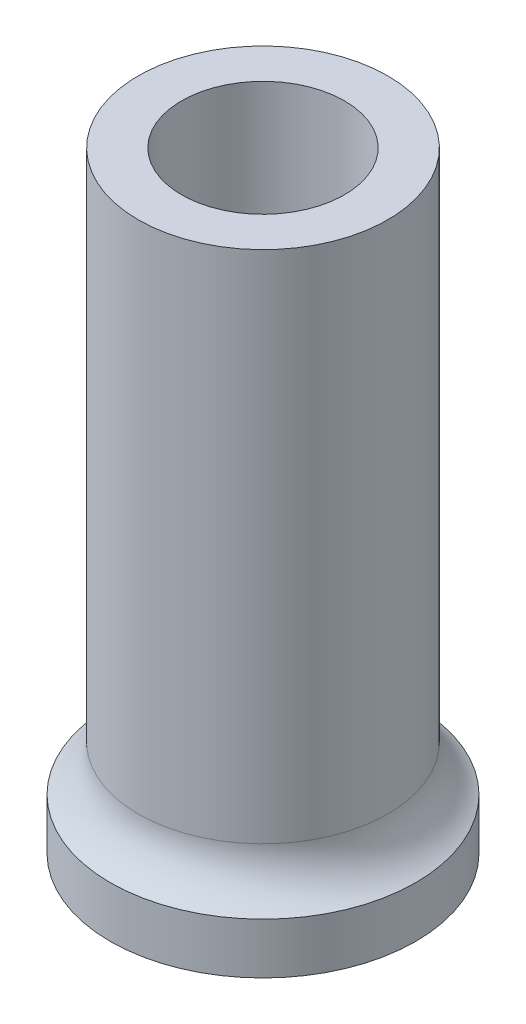
from build123d import *

# Parameters (mm, degrees)
SKETCH1_R           = 2.45
SKETCH1_R_2         = 1.5
BOSS_EXTRUDE1_DEPTH = 11
SKETCH2_R           = 3
BOSS_EXTRUDE2_DEPTH = 1
SKETCH3_R           = 1.6
CUT_EXTRUDE1_DEPTH  = 13.727922061
FILLET2_R           = 1


with BuildPart() as part:
    # Sketch1 → Boss-Extrude1 (new body)
    with BuildSketch(Plane(origin=(0, 0, 0), x_dir=(1, 0, 0), z_dir=(0, 1, 0))):
        with Locations(Location((0, 0, 0), (0, 0, 270))):
            Circle(SKETCH1_R)
        with Locations(Location((0, 0, 0), (0, 0, 270))):
            Circle(SKETCH1_R_2, mode=Mode.SUBTRACT)
    extrude(amount=BOSS_EXTRUDE1_DEPTH)

    # Sketch2 → Boss-Extrude2 (add)
    with BuildSketch(Plane(origin=(0, 0, 0), x_dir=(-1, 0, 0), z_dir=(0, -1, 0))):
        with Locations(Location((0, 0, 0), (0, 0, 90))):
            Circle(SKETCH2_R)
    extrude(amount=BOSS_EXTRUDE2_DEPTH)

    # Sketch3 → Cut-Extrude1 (cut, through all)
    with BuildSketch(Plane(origin=(0, -1, 0), x_dir=(-1, 0, 0), z_dir=(0, -1, 0))):
        with Locations(Location((0, 0, 0), (0, 0, 90))):
            Circle(SKETCH3_R)
    extrude(amount=-CUT_EXTRUDE1_DEPTH, mode=Mode.SUBTRACT)

    # Fillet2
    # the kernel refuses this fillet: 1 mm, written as the material it adds along each edge
    with BuildSketch(Plane(origin=(0, 0, 0), x_dir=(0, 0, 1), z_dir=(-1, 0, 0))) as fillet2_piece_1:
        with BuildLine():
            CenterArc((3.45, 0.893028555), FILLET2_R, 180, 63.25631605)
            Line((2.45, 0.893028555), (2.43, 0.893028555))
            Line((2.43, 0.893028555), (2.43, 0))
            Line((2.43, 0), (2.45, -0.02))
            ThreePointArc((2.45, -0.02), (2.725, -0.02), (2.991, -0.017860571))
            Line((2.991, -0.017860571), (3, 0))
        make_face()
    revolve(axis=Axis((0, 0, 0), (0, 1, 0)))


solid = part.part
